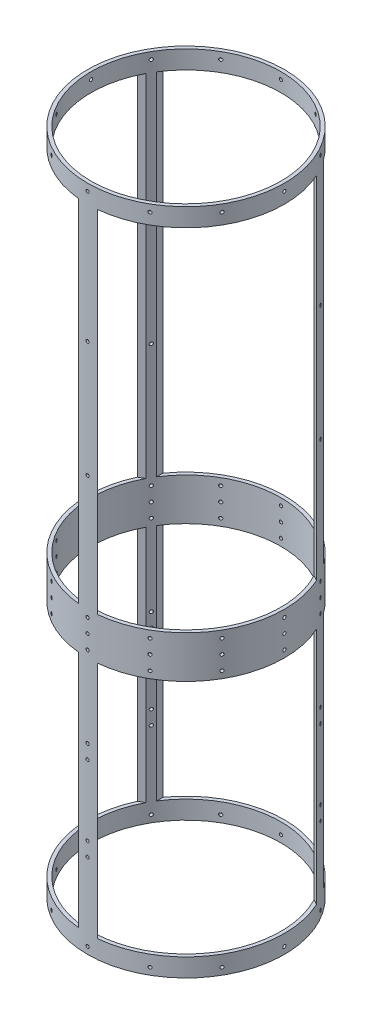
from build123d import *

# Parameters (mm, degrees)
SKETCH1_R                = 88.9
SKETCH1_R_2              = 85.725
BOSS_EXTRUDE1_DEPTH      = 301.625
CUT_EXTRUDE1_REACH       = 328.778
CUT_EXTRUDE1_END_RADIUS  = 88.9
SKETCH2_W                = 144.78
SKETCH2_H                = 215.392
SKETCH2_H_2              = 316.738
CIRPATTERN1_COUNT        = 3
SKETCH3_R                = 1.4351
CUT_EXTRUDE2_DEPTH       = 25.908
CIRPATTERN2_COUNT        = 12
MIRROR1_COPY_1_SKETCH_R  = 1.4351
MIRROR1_COPY_1_DEPTH     = 25.908
MIRROR1_COPY_2_SKETCH_R  = 1.4351
MIRROR1_COPY_2_DEPTH     = 25.908
MIRROR1_COPY_3_SKETCH_R  = 1.4351
MIRROR1_COPY_3_DEPTH     = 25.908
MIRROR1_COPY_4_SKETCH_R  = 1.4351
MIRROR1_COPY_4_DEPTH     = 25.908
MIRROR1_COPY_5_SKETCH_R  = 1.4351
MIRROR1_COPY_5_DEPTH     = 25.908
MIRROR1_COPY_6_SKETCH_R  = 1.4351
MIRROR1_COPY_6_DEPTH     = 25.908
MIRROR1_COPY_7_SKETCH_R  = 1.4351
MIRROR1_COPY_7_DEPTH     = 25.908
MIRROR1_COPY_8_SKETCH_R  = 1.4351
MIRROR1_COPY_8_DEPTH     = 25.908
MIRROR1_COPY_9_SKETCH_R  = 1.4351
MIRROR1_COPY_9_DEPTH     = 25.908
MIRROR1_COPY_10_SKETCH_R = 1.4351
MIRROR1_COPY_10_DEPTH    = 25.908
MIRROR1_COPY_11_SKETCH_R = 1.4351
MIRROR1_COPY_11_DEPTH    = 25.908
MIRROR1_COPY_12_SKETCH_R = 1.4351
MIRROR1_COPY_12_DEPTH    = 25.908
SKETCH4_R                = 1.4351
CUT_EXTRUDE3_DEPTH       = 34.798
CIRPATTERN3_COUNT        = 3
SKETCH5_R                = 1.4351
CUT_EXTRUDE4_DEPTH       = 87.63
CIRPATTERN4_COUNT        = 12


with BuildPart() as part:
    # Sketch1 → Boss-Extrude1 (new, symmetric)
    with BuildSketch(Plane(origin=(0, 0, 0), x_dir=(1, 0, 0), z_dir=(0, 1, 0))):
        Circle(SKETCH1_R)
        Circle(SKETCH1_R_2, mode=Mode.SUBTRACT)
    extrude(amount=BOSS_EXTRUDE1_DEPTH, both=True)

    # Cut-Extrude1: up to this cylinder (the profile starts inside it)
    cut_extrude1_end = Plane(origin=(0, -25.3365, 0), z_dir=(0, -1, 0)) * Cylinder(CUT_EXTRUDE1_END_RADIUS, 1140.521, mode=Mode.PRIVATE)
    # Sketch2 → Cut-Extrude1 (cut, up to the surface)
    with BuildSketch(Plane.XY, mode=Mode.PRIVATE) as cut_extrude1_sk1:
        with Locations((0, -177.419)):
            Rectangle(SKETCH2_W, SKETCH2_H)
    cut_extrude1_tool1 = extrude(cut_extrude1_sk1.sketch, amount=-CUT_EXTRUDE1_REACH, mode=Mode.PRIVATE) & cut_extrude1_end
    # Sketch2 → Cut-Extrude1 (cut, up to the surface)
    with BuildSketch(Plane.XY, mode=Mode.PRIVATE) as cut_extrude1_sk2:
        with Locations((0, 126.746)):
            Rectangle(SKETCH2_W, SKETCH2_H_2)
    cut_extrude1_tool2 = extrude(cut_extrude1_sk2.sketch, amount=-CUT_EXTRUDE1_REACH, mode=Mode.PRIVATE) & cut_extrude1_end
    cut_extrude1 = cut_extrude1_tool1.solids().sort_by_distance((0, -177.419, 0))[0] + cut_extrude1_tool2.solids().sort_by_distance((0, 126.746, 0))[0]
    add(cut_extrude1, mode=Mode.SUBTRACT)

    # CirPattern1: Cut-Extrude1 ×3 about axis
    cirpattern1_axis = Axis((0, 301.625, 0), (0, -1, 0))
    for i in range(1, CIRPATTERN1_COUNT):
        add(cut_extrude1.rotate(cirpattern1_axis, i * 360 / CIRPATTERN1_COUNT), mode=Mode.SUBTRACT)

    # Sketch3 → Cut-Extrude2 (cut)
    with BuildSketch(Plane.XY.offset(88.9)):
        with Locations((0, 295.275)):
            Circle(SKETCH3_R)
    cut_extrude2 = extrude(amount=-CUT_EXTRUDE2_DEPTH, mode=Mode.SUBTRACT)

    # CirPattern2: Cut-Extrude2 ×12 about axis
    cirpattern2_axis = Axis((0, 301.625, 0), (0, -1, 0))
    for i in range(1, CIRPATTERN2_COUNT):
        add(cut_extrude2.rotate(cirpattern2_axis, i * 360 / CIRPATTERN2_COUNT), mode=Mode.SUBTRACT)

    # Mirror1 copy 1 sketch → Mirror1 copy 1 (cut)
    with BuildSketch(Plane(origin=(-44.45, 0, 76.989658396), x_dir=(0.8660254037844387, 0, 0.49999999999999994), z_dir=(-0.49999999999999994, 0, 0.8660254037844387))):
        with Locations((0, -295.275)):
            Circle(MIRROR1_COPY_1_SKETCH_R)
    extrude(amount=-MIRROR1_COPY_1_DEPTH, mode=Mode.SUBTRACT)

    # Mirror1 copy 2 sketch → Mirror1 copy 2 (cut)
    with BuildSketch(Plane(origin=(-76.989658396, 0, 44.45), x_dir=(0.5000000000000001, 0, 0.8660254037844386), z_dir=(-0.8660254037844386, 0, 0.5000000000000001))):
        with Locations((0, -295.275)):
            Circle(MIRROR1_COPY_2_SKETCH_R)
    extrude(amount=-MIRROR1_COPY_2_DEPTH, mode=Mode.SUBTRACT)

    # Mirror1 copy 3 sketch → Mirror1 copy 3 (cut)
    with BuildSketch(Plane.ZY.offset(88.9)):
        with Locations((0, -295.275)):
            Circle(MIRROR1_COPY_3_SKETCH_R)
    extrude(amount=-MIRROR1_COPY_3_DEPTH, mode=Mode.SUBTRACT)

    # Mirror1 copy 4 sketch → Mirror1 copy 4 (cut)
    with BuildSketch(Plane(origin=(-76.989658396, 0, -44.45), x_dir=(-0.4999999999999998, 0, 0.8660254037844387), z_dir=(-0.8660254037844387, 0, -0.4999999999999998))):
        with Locations((0, -295.275)):
            Circle(MIRROR1_COPY_4_SKETCH_R)
    extrude(amount=-MIRROR1_COPY_4_DEPTH, mode=Mode.SUBTRACT)

    # Mirror1 copy 5 sketch → Mirror1 copy 5 (cut)
    with BuildSketch(Plane(origin=(-44.45, 0, -76.989658396), x_dir=(-0.8660254037844387, 0, 0.49999999999999994), z_dir=(-0.49999999999999994, 0, -0.8660254037844387))):
        with Locations((0, -295.275)):
            Circle(MIRROR1_COPY_5_SKETCH_R)
    extrude(amount=-MIRROR1_COPY_5_DEPTH, mode=Mode.SUBTRACT)

    # Mirror1 copy 6 sketch → Mirror1 copy 6 (cut)
    with BuildSketch(Plane(origin=(0, 0, -88.9), x_dir=(-1, 0, 0), z_dir=(0, 0, -1))):
        with Locations((0, -295.275)):
            Circle(MIRROR1_COPY_6_SKETCH_R)
    extrude(amount=-MIRROR1_COPY_6_DEPTH, mode=Mode.SUBTRACT)

    # Mirror1 copy 7 sketch → Mirror1 copy 7 (cut)
    with BuildSketch(Plane(origin=(44.45, 0, -76.989658396), x_dir=(-0.8660254037844386, 0, -0.5000000000000001), z_dir=(0.5000000000000001, 0, -0.8660254037844386))):
        with Locations((0, -295.275)):
            Circle(MIRROR1_COPY_7_SKETCH_R)
    extrude(amount=-MIRROR1_COPY_7_DEPTH, mode=Mode.SUBTRACT)

    # Mirror1 copy 8 sketch → Mirror1 copy 8 (cut)
    with BuildSketch(Plane(origin=(76.989658396, 0, -44.45), x_dir=(-0.5000000000000004, 0, -0.8660254037844384), z_dir=(0.8660254037844384, 0, -0.5000000000000004))):
        with Locations((0, -295.275)):
            Circle(MIRROR1_COPY_8_SKETCH_R)
    extrude(amount=-MIRROR1_COPY_8_DEPTH, mode=Mode.SUBTRACT)

    # Mirror1 copy 9 sketch → Mirror1 copy 9 (cut)
    with BuildSketch(Plane(origin=(88.9, 0, 0), x_dir=(0, 0, -1), z_dir=(1, 0, 0))):
        with Locations((0, -295.275)):
            Circle(MIRROR1_COPY_9_SKETCH_R)
    extrude(amount=-MIRROR1_COPY_9_DEPTH, mode=Mode.SUBTRACT)

    # Mirror1 copy 10 sketch → Mirror1 copy 10 (cut)
    with BuildSketch(Plane(origin=(76.989658396, 0, 44.45), x_dir=(0.5000000000000001, 0, -0.8660254037844386), z_dir=(0.8660254037844386, 0, 0.5000000000000001))):
        with Locations((0, -295.275)):
            Circle(MIRROR1_COPY_10_SKETCH_R)
    extrude(amount=-MIRROR1_COPY_10_DEPTH, mode=Mode.SUBTRACT)

    # Mirror1 copy 11 sketch → Mirror1 copy 11 (cut)
    with BuildSketch(Plane(origin=(44.45, 0, 76.989658396), x_dir=(0.8660254037844384, 0, -0.5000000000000004), z_dir=(0.5000000000000004, 0, 0.8660254037844384))):
        with Locations((0, -295.275)):
            Circle(MIRROR1_COPY_11_SKETCH_R)
    extrude(amount=-MIRROR1_COPY_11_DEPTH, mode=Mode.SUBTRACT)

    # Mirror1 copy 12 sketch → Mirror1 copy 12 (cut)
    with BuildSketch(Plane.XY.offset(88.9)):
        with Locations((0, -295.275)):
            Circle(MIRROR1_COPY_12_SKETCH_R)
    extrude(amount=-MIRROR1_COPY_12_DEPTH, mode=Mode.SUBTRACT)

    # Sketch4 → Cut-Extrude3 (cut)
    with BuildSketch(Plane.XY.offset(88.9)):
        with Locations((0, -225.425)):
            Circle(SKETCH4_R)
        with Locations((0, -212.725)):
            Circle(SKETCH4_R)
        with Locations((0, -149.225)):
            Circle(SKETCH4_R)
        with Locations((0, -136.525)):
            Circle(SKETCH4_R)
    cut_extrude3 = extrude(amount=-CUT_EXTRUDE3_DEPTH, mode=Mode.SUBTRACT)

    # CirPattern3: Cut-Extrude3 ×3 about axis
    cirpattern3_axis = Axis((0, 301.625, 0), (0, -1, 0))
    for i in range(1, CIRPATTERN3_COUNT):
        add(cut_extrude3.rotate(cirpattern3_axis, i * 360 / CIRPATTERN3_COUNT), mode=Mode.SUBTRACT)

    # Sketch5 → Cut-Extrude4 (cut)
    with BuildSketch(Plane.XY.offset(88.9)):
        with Locations((0, -50.673)):
            Circle(SKETCH5_R)
        with Locations((0, 73.025)):
            Circle(SKETCH5_R)
        with Locations((0, 177.927)):
            Circle(SKETCH5_R)
        with Locations((0, -37.973)):
            Circle(SKETCH5_R)
        with Locations((0, -63.373)):
            Circle(SKETCH5_R)
    cut_extrude4 = extrude(amount=-CUT_EXTRUDE4_DEPTH, mode=Mode.SUBTRACT)

    # CirPattern4: Cut-Extrude4 ×12 about axis
    cirpattern4_axis = Axis((0, 301.625, 0), (0, -1, 0))
    for i in range(1, CIRPATTERN4_COUNT):
        add(cut_extrude4.rotate(cirpattern4_axis, i * 360 / CIRPATTERN4_COUNT), mode=Mode.SUBTRACT)


solid = part.part
